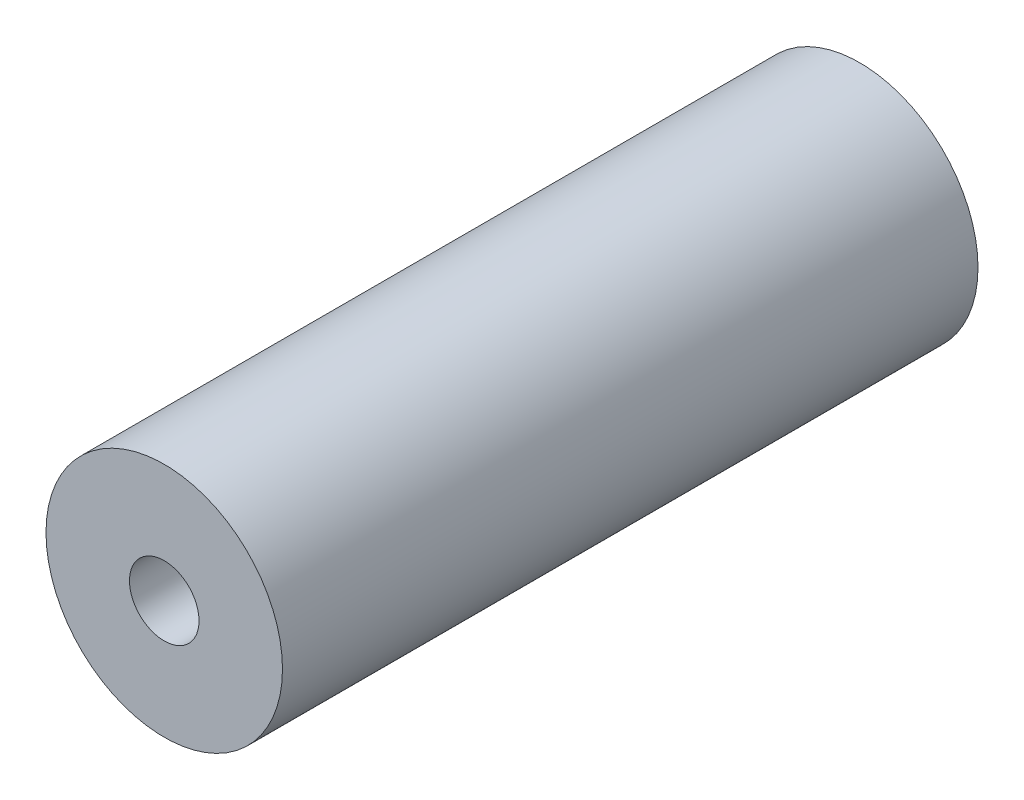
from build123d import *

# Parameters (mm, degrees)
SKETCH1_R           = 8.5
SKETCH1_R_2         = 2.5
BOSS_EXTRUDE1_DEPTH = 25


with BuildPart() as part:
    # Sketch1 → Boss-Extrude1 (new, symmetric)
    with BuildSketch(Plane.XY):
        Circle(SKETCH1_R)
        Circle(SKETCH1_R_2, mode=Mode.SUBTRACT)
    extrude(amount=BOSS_EXTRUDE1_DEPTH, both=True)


solid = part.part
